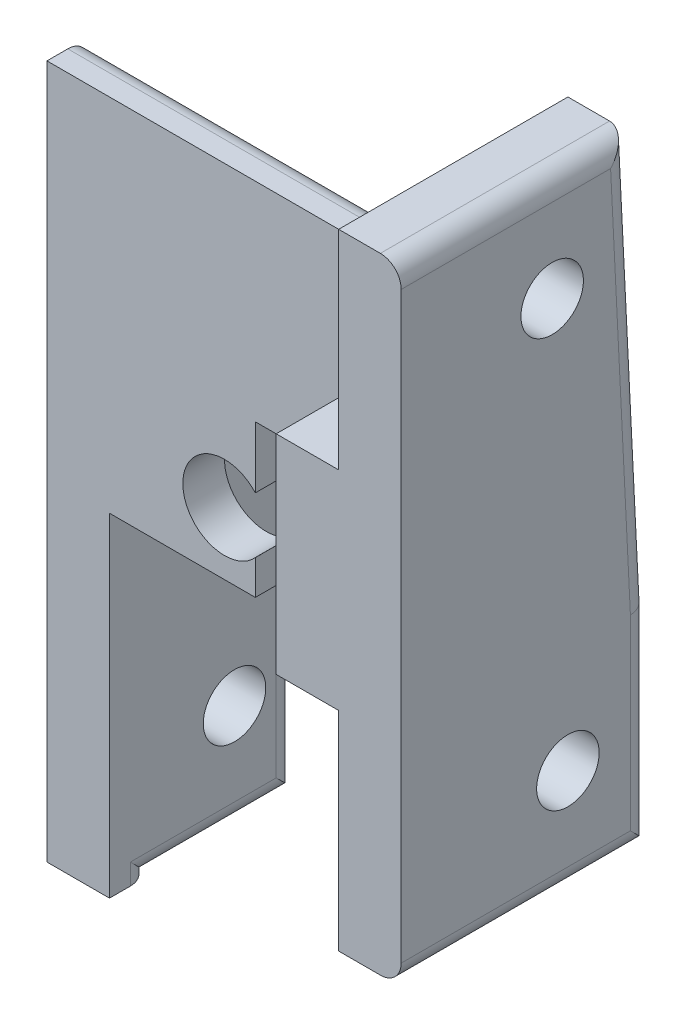
from build123d import *

# Parameters (mm, degrees)
CROQUIS1_W              = 24
CROQUIS1_H              = 33.3
SALIENTE_EXTRUIR2_DEPTH = 7
CROQUIS3_W              = 4
CROQUIS3_H              = 19
CORTAR_EXTRUIR1_DEPTH   = 42.640004803
CROQUIS7_R              = 1.5
SALIENTE_EXTRUIR3_DEPTH = 3
CROQUIS8_W              = 18
CROQUIS8_H              = 10
CROQUIS8_R              = 1.5
SALIENTE_EXTRUIR5_DEPTH = 3
SALIENTE_EXTRUIR6_START = -2
CROQUIS9_W              = 18
CROQUIS9_H              = 10
CROQUIS9_R              = 1.5
SALIENTE_EXTRUIR6_DEPTH = 2
CROQUIS10_W             = 24
CROQUIS10_H             = 10
SALIENTE_EXTRUIR7_DEPTH = 3
CROQUIS11_W             = 19
CROQUIS11_H             = 38
CORTAR_EXTRUIR5_DEPTH   = 57.986752847
CROQUIS15_W             = 7
CROQUIS15_H             = 10
CORTAR_EXTRUIR8_DEPTH   = 59.004223984
CROQUIS16_W             = 7
CROQUIS16_H             = 16
CORTAR_EXTRUIR9_DEPTH   = 2
CROQUIS18_R             = 1.5
CROQUIS18_W             = 24
CROQUIS18_H             = 10
SALIENTE_EXTRUIR8_DEPTH = 3
REDONDEO1_R             = 1
CROQUIS19_W             = 27
CROQUIS19_H             = 19
CORTAR_EXTRUIR11_DEPTH  = 67.973800848
CROQUIS21_R             = 2
CORTAR_EXTRUIR12_DEPTH  = 10
CROQUIS22_W             = 12
CROQUIS22_H             = 11
CORTAR_EXTRUIR13_DEPTH  = 52.792760112


with BuildPart() as part:
    # Croquis1 → Saliente-Extruir2 (new body)
    with BuildSketch(Plane(origin=(0, 0, 0), x_dir=(0, 0, -1), z_dir=(1, 0, 0))):
        with Locations((-12, -16.65)):
            Rectangle(CROQUIS1_W, CROQUIS1_H)
    extrude(amount=SALIENTE_EXTRUIR2_DEPTH)

    # Croquis3 → Cortar-Extruir1 (cut, through all)
    with BuildSketch(Plane(origin=(0, 0, 0), x_dir=(1, 0, 0), z_dir=(0, 1, 0))):
        with Locations((5, -11.5)):
            Rectangle(CROQUIS3_W, CROQUIS3_H)
    extrude(amount=-CORTAR_EXTRUIR1_DEPTH, mode=Mode.SUBTRACT)



with BuildPart() as body_2:
    # Croquis7 → Saliente-Extruir3 (new body)
    with BuildSketch(Plane.ZY):
        Polygon((-7, 0), (-7, -33.3), (0, -33.3), (0, -44.3), (24, -44.3), (24, -33.3), (31, -33.3), (31, 0), align=None)
        with Locations((-4, -28.3)):
            Circle(CROQUIS7_R, mode=Mode.SUBTRACT)
        with Locations((-4, -15)):
            Circle(CROQUIS7_R, mode=Mode.SUBTRACT)
        with Locations((28, -15)):
            Circle(CROQUIS7_R, mode=Mode.SUBTRACT)
        with Locations((28, -28.3)):
            Circle(CROQUIS7_R, mode=Mode.SUBTRACT)
        with Locations((20, -40.3)):
            Circle(CROQUIS7_R, mode=Mode.SUBTRACT)
        with Locations((4, -40.3)):
            Circle(CROQUIS7_R, mode=Mode.SUBTRACT)
    extrude(amount=SALIENTE_EXTRUIR3_DEPTH)


with BuildPart() as part_1:
    add(part.part)

    add(body_2.part)  # Saliente-Extruir5 merges body 2
    # Croquis8 → Saliente-Extruir5 (add)
    with BuildSketch(Plane.XY.offset(24)):
        with Locations((9, -5)):
            Rectangle(CROQUIS8_W, CROQUIS8_H)
        with Locations((15, -5)):
            Circle(CROQUIS8_R, mode=Mode.SUBTRACT)
        with Locations((3, -5)):
            Circle(CROQUIS8_R, mode=Mode.SUBTRACT)
    extrude(amount=-SALIENTE_EXTRUIR5_DEPTH)

    # Croquis9 → Saliente-Extruir6 (add)
    with BuildSketch(Plane(origin=(0, 0, 0), x_dir=(-1, 0, 0), z_dir=(0, 0, -1)).offset(SALIENTE_EXTRUIR6_START)):
        with Locations((-9, -5)):
            Rectangle(CROQUIS9_W, CROQUIS9_H)
        with Locations(Location((-15, -5, 0), (0, 0, 180))):
            Circle(CROQUIS9_R, mode=Mode.SUBTRACT)
    extrude(amount=SALIENTE_EXTRUIR6_DEPTH)

    # Croquis10 → Saliente-Extruir7 (add)
    with BuildSketch(Plane(origin=(18, 0, 0), x_dir=(0, 0, -1), z_dir=(1, 0, 0))):
        with Locations((-12, -5)):
            Rectangle(CROQUIS10_W, CROQUIS10_H)
    extrude(amount=SALIENTE_EXTRUIR7_DEPTH)

    # Croquis11 → Cortar-Extruir5 (cut, through all)
    with BuildSketch(Plane(origin=(3, 0, 0), x_dir=(0, 0, -1), z_dir=(1, 0, 0))):
        with Locations((-11.5, -19)):
            Rectangle(CROQUIS11_W, CROQUIS11_H)
    extrude(amount=-CORTAR_EXTRUIR5_DEPTH, mode=Mode.SUBTRACT)

    # Croquis15 → Cortar-Extruir8 (cut, through all)
    with BuildSketch(Plane(origin=(0, 0, 0), x_dir=(0, 0, -1), z_dir=(1, 0, 0))):
        with Locations((-27.5, -5)):
            Rectangle(CROQUIS15_W, CROQUIS15_H)
        with Locations((3.5, -5)):
            Rectangle(CROQUIS15_W, CROQUIS15_H)
    extrude(amount=-CORTAR_EXTRUIR8_DEPTH, mode=Mode.SUBTRACT)

    # Croquis16 → Cortar-Extruir9 (cut)
    with BuildSketch(Plane(origin=(0, 0, 0), x_dir=(-1, 0, 0), z_dir=(0, 0, -1))):
        with Locations((-3.5, -25.3)):
            Rectangle(CROQUIS16_W, CROQUIS16_H)
    extrude(amount=-CORTAR_EXTRUIR9_DEPTH, mode=Mode.SUBTRACT)

    # Croquis18 → Saliente-Extruir8 (add)
    # profile 1 of 2: a face of its own
    with BuildSketch(Plane(origin=(21, 0, 0), x_dir=(0, 0, -1), z_dir=(1, 0, 0))):
        Polygon((-24, 10), (-24, -10), (0, -10), (-1, 10), align=None)
        with Locations((-20, 5)):
            Circle(CROQUIS18_R, mode=Mode.SUBTRACT)
        with Locations((-4.754996879, 5)):
            Circle(CROQUIS18_R, mode=Mode.SUBTRACT)
    # profile 2 of 2: a face of its own
    with BuildSketch(Plane(origin=(21, 0, 0), x_dir=(0, 0, -1), z_dir=(1, 0, 0))):
        with Locations((-12, -15)):
            Rectangle(CROQUIS18_W, CROQUIS18_H)
        with Locations((-20, -15)):
            Circle(CROQUIS18_R, mode=Mode.SUBTRACT)
        with Locations((-4, -15)):
            Circle(CROQUIS18_R, mode=Mode.SUBTRACT)
    extrude(amount=SALIENTE_EXTRUIR8_DEPTH)

    # Redondeo1
    # the kernel refuses this fillet: 1 mm, written as the material it takes off along each edge
    with BuildSketch(Plane(origin=(0, -33.3, 31), x_dir=(0, 0, -1), z_dir=(0, 1, 0)), Plane(origin=(0, -10, -7), x_dir=(0, 0, 1), z_dir=(0, -1, 0))) as redondeo1_piece_1:
        with BuildLine():
            CenterArc((REDONDEO1_R, REDONDEO1_R), REDONDEO1_R, 180, 90)
            Line((0, REDONDEO1_R), (-REDONDEO1_R * 0.02, REDONDEO1_R))
            Line((-REDONDEO1_R * 0.02, REDONDEO1_R), (-REDONDEO1_R * 0.02, -REDONDEO1_R * 0.02))
            Line((-REDONDEO1_R * 0.02, -REDONDEO1_R * 0.02), (REDONDEO1_R, -REDONDEO1_R * 0.02))
            Line((REDONDEO1_R, -REDONDEO1_R * 0.02), (REDONDEO1_R, 0))
        make_face()
    extrude(amount=23.3, mode=Mode.SUBTRACT)
    with BuildSketch(Plane(origin=(0, -10, 24), x_dir=(-1, 0, 0), z_dir=(0, 0, 1)), Plane(origin=(0, -10, -7), x_dir=(-1, 0, 0), z_dir=(0, 0, 1)), Plane(origin=(0, -33.3, 24), x_dir=(0, 1, 0), z_dir=(0, 0, 1)), Plane(origin=(0, -33.3, -7), x_dir=(0, 1, 0), z_dir=(0, 0, 1))) as redondeo1_piece_2:
        with BuildLine():
            CenterArc((REDONDEO1_R, REDONDEO1_R), REDONDEO1_R, 180, 90)
            Line((0, REDONDEO1_R), (-REDONDEO1_R * 0.02, REDONDEO1_R))
            Line((-REDONDEO1_R * 0.02, REDONDEO1_R), (-REDONDEO1_R * 0.02, -REDONDEO1_R * 0.02))
            Line((-REDONDEO1_R * 0.02, -REDONDEO1_R * 0.02), (REDONDEO1_R, -REDONDEO1_R * 0.02))
            Line((REDONDEO1_R, -REDONDEO1_R * 0.02), (REDONDEO1_R, 0))
        make_face()
    extrude(amount=7, mode=Mode.SUBTRACT)
    with BuildSketch(Plane(origin=(24, -20, 24), x_dir=(-1, 0, 0), z_dir=(0, 1, 0))) as redondeo1_piece_3:
        with BuildLine():
            CenterArc((REDONDEO1_R, -REDONDEO1_R), REDONDEO1_R, 90, 90)
            Line((0, -REDONDEO1_R), (-REDONDEO1_R * 0.02, -REDONDEO1_R))
            Line((-REDONDEO1_R * 0.02, -REDONDEO1_R), (-REDONDEO1_R * 0.02, REDONDEO1_R * 0.02))
            Line((-REDONDEO1_R * 0.02, REDONDEO1_R * 0.02), (REDONDEO1_R, REDONDEO1_R * 0.02))
            Line((REDONDEO1_R, REDONDEO1_R * 0.02), (REDONDEO1_R, 0))
        make_face()
    extrude(amount=30, mode=Mode.SUBTRACT)
    with BuildSketch(Plane(origin=(24, -20, 0), x_dir=(0, 0, 1), z_dir=(0, 1, 0))) as redondeo1_piece_4_section:
        with BuildLine():
            CenterArc((REDONDEO1_R, -REDONDEO1_R), REDONDEO1_R, 90, 90)
            Line((0, -REDONDEO1_R), (-REDONDEO1_R * 0.02, -REDONDEO1_R))
            Line((-REDONDEO1_R * 0.02, -REDONDEO1_R), (-REDONDEO1_R * 0.02, REDONDEO1_R * 0.02))
            Line((-REDONDEO1_R * 0.02, REDONDEO1_R * 0.02), (REDONDEO1_R, REDONDEO1_R * 0.02))
            Line((REDONDEO1_R, REDONDEO1_R * 0.02), (REDONDEO1_R, 0))
        make_face()
    redondeo1_piece_4 = extrude(amount=12.5, mode=Mode.PRIVATE)
    redondeo1_piece_4 = split(redondeo1_piece_4, bisect_by=Plane(origin=(23.783903018, -14.02846616, -0.201423308), z_dir=(0, -0.049937616943892635, 0.9987523388778446)), keep=Keep.TOP, mode=Mode.PRIVATE)
    add(redondeo1_piece_4, mode=Mode.SUBTRACT)
    with BuildSketch(Plane(origin=(24, 10, -1.5), x_dir=(-1, 0, 0), z_dir=(0, 0, 1))) as redondeo1_piece_5_section:
        with BuildLine():
            CenterArc((REDONDEO1_R, REDONDEO1_R), REDONDEO1_R, 180, 90)
            Line((0, REDONDEO1_R), (-REDONDEO1_R * 0.02, REDONDEO1_R))
            Line((-REDONDEO1_R * 0.02, REDONDEO1_R), (-REDONDEO1_R * 0.02, -REDONDEO1_R * 0.02))
            Line((-REDONDEO1_R * 0.02, -REDONDEO1_R * 0.02), (REDONDEO1_R, -REDONDEO1_R * 0.02))
            Line((REDONDEO1_R, -REDONDEO1_R * 0.02), (REDONDEO1_R, 0))
        make_face()
    redondeo1_piece_5 = extrude(amount=25.5, mode=Mode.PRIVATE)
    redondeo1_piece_5 = split(redondeo1_piece_5, bisect_by=Plane(origin=(23.773664545, 10.347352398, 1.01736762), z_dir=(0, -0.049937616943892635, 0.9987523388778446)), keep=Keep.TOP, mode=Mode.PRIVATE)
    add(redondeo1_piece_5, mode=Mode.SUBTRACT)
    with BuildSketch(Plane(origin=(24, -20, 24), x_dir=(0, 1, 0), z_dir=(0, 0, -1)), Plane(origin=(-3, 0, 24), x_dir=(0, 0, -1), z_dir=(1, 0, 0)), Plane(origin=(21, 0, 0), x_dir=(0, 0, 1), z_dir=(-1, 0, 0))) as redondeo1_piece_6:
        with BuildLine():
            CenterArc((REDONDEO1_R, -REDONDEO1_R), REDONDEO1_R, 90, 90)
            Line((0, -REDONDEO1_R), (-REDONDEO1_R * 0.02, -REDONDEO1_R))
            Line((-REDONDEO1_R * 0.02, -REDONDEO1_R), (-REDONDEO1_R * 0.02, REDONDEO1_R * 0.02))
            Line((-REDONDEO1_R * 0.02, REDONDEO1_R * 0.02), (REDONDEO1_R, REDONDEO1_R * 0.02))
            Line((REDONDEO1_R, REDONDEO1_R * 0.02), (REDONDEO1_R, 0))
        make_face()
    extrude(amount=24, mode=Mode.SUBTRACT)
    with BuildSketch(Plane(origin=(24, -12.496880847, -0.124844042), x_dir=(-1, 0, 0), z_dir=(0, 0.9987523388778446, 0.049937616943892635))) as redondeo1_piece_7_section:
        with BuildLine():
            CenterArc((REDONDEO1_R, REDONDEO1_R), REDONDEO1_R, 180, 90)
            Line((0, REDONDEO1_R), (-REDONDEO1_R * 0.02, REDONDEO1_R))
            Line((-REDONDEO1_R * 0.02, REDONDEO1_R), (-REDONDEO1_R * 0.02, -REDONDEO1_R * 0.02))
            Line((-REDONDEO1_R * 0.02, -REDONDEO1_R * 0.02), (REDONDEO1_R, -REDONDEO1_R * 0.02))
            Line((REDONDEO1_R, -REDONDEO1_R * 0.02), (REDONDEO1_R, 0))
        make_face()
    redondeo1_piece_7 = extrude(amount=25.024984395, mode=Mode.PRIVATE)
    redondeo1_piece_7 = split(redondeo1_piece_7, bisect_by=Plane(origin=(23.779237021, -0.936247577, 0), z_dir=(0, 0, 1)), keep=Keep.TOP, mode=Mode.PRIVATE)
    redondeo1_piece_7 = split(redondeo1_piece_7, bisect_by=Plane(origin=(23.779237021, 10, 0.686324779), z_dir=(0, -1, 0)), keep=Keep.TOP, mode=Mode.PRIVATE)
    add(redondeo1_piece_7, mode=Mode.SUBTRACT)
    with BuildSketch(Plane(origin=(7, -33.3, 24), x_dir=(-1, 0, 0), z_dir=(0, 1, 0))) as redondeo1_piece_8:
        with BuildLine():
            CenterArc((REDONDEO1_R, -REDONDEO1_R), REDONDEO1_R, 90, 90)
            Line((0, -REDONDEO1_R), (-REDONDEO1_R * 0.02, -REDONDEO1_R))
            Line((-REDONDEO1_R * 0.02, -REDONDEO1_R), (-REDONDEO1_R * 0.02, REDONDEO1_R * 0.02))
            Line((-REDONDEO1_R * 0.02, REDONDEO1_R * 0.02), (REDONDEO1_R, REDONDEO1_R * 0.02))
            Line((REDONDEO1_R, REDONDEO1_R * 0.02), (REDONDEO1_R, 0))
        make_face()
    extrude(amount=23.3, mode=Mode.SUBTRACT)
    with BuildSketch(Plane(origin=(7, -10, 24), x_dir=(0, 1, 0), z_dir=(1, 0, 0))) as redondeo1_piece_9:
        with BuildLine():
            CenterArc((REDONDEO1_R, -REDONDEO1_R), REDONDEO1_R, 90, 90)
            Line((0, -REDONDEO1_R), (-REDONDEO1_R * 0.02, -REDONDEO1_R))
            Line((-REDONDEO1_R * 0.02, -REDONDEO1_R), (-REDONDEO1_R * 0.02, REDONDEO1_R * 0.02))
            Line((-REDONDEO1_R * 0.02, REDONDEO1_R * 0.02), (REDONDEO1_R, REDONDEO1_R * 0.02))
            Line((REDONDEO1_R, REDONDEO1_R * 0.02), (REDONDEO1_R, 0))
        make_face()
    extrude(amount=14, mode=Mode.SUBTRACT)
    with BuildSketch(Plane(origin=(0, -33.3, 0), x_dir=(0, 0, 1), z_dir=(0, -1, 0))) as redondeo1_piece_10:
        with BuildLine():
            CenterArc((REDONDEO1_R, REDONDEO1_R), REDONDEO1_R, 180, 90)
            Line((0, REDONDEO1_R), (-REDONDEO1_R * 0.02, REDONDEO1_R))
            Line((-REDONDEO1_R * 0.02, REDONDEO1_R), (-REDONDEO1_R * 0.02, -REDONDEO1_R * 0.02))
            Line((-REDONDEO1_R * 0.02, -REDONDEO1_R * 0.02), (REDONDEO1_R, -REDONDEO1_R * 0.02))
            Line((REDONDEO1_R, -REDONDEO1_R * 0.02), (REDONDEO1_R, 0))
        make_face()
    extrude(amount=11, mode=Mode.SUBTRACT)
    with BuildSketch(Plane(origin=(0, -44.3, 0), x_dir=(0, 1, 0), z_dir=(0, 0, 1))) as redondeo1_piece_11:
        with BuildLine():
            CenterArc((REDONDEO1_R, REDONDEO1_R), REDONDEO1_R, 180, 90)
            Line((0, REDONDEO1_R), (-REDONDEO1_R * 0.02, REDONDEO1_R))
            Line((-REDONDEO1_R * 0.02, REDONDEO1_R), (-REDONDEO1_R * 0.02, -REDONDEO1_R * 0.02))
            Line((-REDONDEO1_R * 0.02, -REDONDEO1_R * 0.02), (REDONDEO1_R, -REDONDEO1_R * 0.02))
            Line((REDONDEO1_R, -REDONDEO1_R * 0.02), (REDONDEO1_R, 0))
        make_face()
    extrude(amount=24, mode=Mode.SUBTRACT)
    with BuildSketch(Plane(origin=(0, -35.8, 31), x_dir=(0, 0, -1), z_dir=(0, 1, 0))) as redondeo1_piece_12a_section:
        with BuildLine():
            CenterArc((REDONDEO1_R, REDONDEO1_R), REDONDEO1_R, 180, 90)
            Line((0, REDONDEO1_R), (-REDONDEO1_R * 0.02, REDONDEO1_R))
            Line((-REDONDEO1_R * 0.02, REDONDEO1_R), (-REDONDEO1_R * 0.02, -REDONDEO1_R * 0.02))
            Line((-REDONDEO1_R * 0.02, -REDONDEO1_R * 0.02), (REDONDEO1_R, -REDONDEO1_R * 0.02))
            Line((REDONDEO1_R, -REDONDEO1_R * 0.02), (REDONDEO1_R, 0))
        make_face()
    redondeo1_piece_12a = extrude(amount=25.8, mode=Mode.PRIVATE)
    redondeo1_piece_12a = split(redondeo1_piece_12a, bisect_by=Plane(origin=(-0.226395114, -33.3, 30.773604886), z_dir=(0, -1, 0)), keep=Keep.TOP, mode=Mode.PRIVATE)
    with BuildSketch(Plane(origin=(0, -33.3, 24), x_dir=(0, 1, 0), z_dir=(0, 0, 1))) as redondeo1_piece_12b_section:
        with BuildLine():
            CenterArc((REDONDEO1_R, REDONDEO1_R), REDONDEO1_R, 180, 90)
            Line((0, REDONDEO1_R), (-REDONDEO1_R * 0.02, REDONDEO1_R))
            Line((-REDONDEO1_R * 0.02, REDONDEO1_R), (-REDONDEO1_R * 0.02, -REDONDEO1_R * 0.02))
            Line((-REDONDEO1_R * 0.02, -REDONDEO1_R * 0.02), (REDONDEO1_R, -REDONDEO1_R * 0.02))
            Line((REDONDEO1_R, -REDONDEO1_R * 0.02), (REDONDEO1_R, 0))
        make_face()
    redondeo1_piece_12b = extrude(amount=9.5, mode=Mode.PRIVATE)
    redondeo1_piece_12b = split(redondeo1_piece_12b, bisect_by=Plane(origin=(-0.226395114, -33.073604886, 31), z_dir=(0, 0, 1)), keep=Keep.TOP, mode=Mode.PRIVATE)
    redondeo1_piece_12 = redondeo1_piece_12a & redondeo1_piece_12b
    add(redondeo1_piece_12, mode=Mode.SUBTRACT)
    with BuildSketch(Plane(origin=(0, -10, 24), x_dir=(-1, 0, 0), z_dir=(0, 0, 1))) as redondeo1_piece_13a_section:
        with BuildLine():
            CenterArc((REDONDEO1_R, REDONDEO1_R), REDONDEO1_R, 180, 90)
            Line((0, REDONDEO1_R), (-REDONDEO1_R * 0.02, REDONDEO1_R))
            Line((-REDONDEO1_R * 0.02, REDONDEO1_R), (-REDONDEO1_R * 0.02, -REDONDEO1_R * 0.02))
            Line((-REDONDEO1_R * 0.02, -REDONDEO1_R * 0.02), (REDONDEO1_R, -REDONDEO1_R * 0.02))
            Line((REDONDEO1_R, -REDONDEO1_R * 0.02), (REDONDEO1_R, 0))
        make_face()
    redondeo1_piece_13a = extrude(amount=9.5, mode=Mode.PRIVATE)
    redondeo1_piece_13a = split(redondeo1_piece_13a, bisect_by=Plane(origin=(-0.226395114, -10.226395114, 31), z_dir=(0, 0, 1)), keep=Keep.TOP, mode=Mode.PRIVATE)
    with BuildSketch(Plane(origin=(0, -33.3, 31), x_dir=(0, 0, -1), z_dir=(0, 1, 0))) as redondeo1_piece_13b_section:
        with BuildLine():
            CenterArc((REDONDEO1_R, REDONDEO1_R), REDONDEO1_R, 180, 90)
            Line((0, REDONDEO1_R), (-REDONDEO1_R * 0.02, REDONDEO1_R))
            Line((-REDONDEO1_R * 0.02, REDONDEO1_R), (-REDONDEO1_R * 0.02, -REDONDEO1_R * 0.02))
            Line((-REDONDEO1_R * 0.02, -REDONDEO1_R * 0.02), (REDONDEO1_R, -REDONDEO1_R * 0.02))
            Line((REDONDEO1_R, -REDONDEO1_R * 0.02), (REDONDEO1_R, 0))
        make_face()
    redondeo1_piece_13b = extrude(amount=25.8, mode=Mode.PRIVATE)
    redondeo1_piece_13b = split(redondeo1_piece_13b, bisect_by=Plane(origin=(-0.226395114, -10, 30.773604886), z_dir=(0, 1, 0)), keep=Keep.TOP, mode=Mode.PRIVATE)
    redondeo1_piece_13 = redondeo1_piece_13a & redondeo1_piece_13b
    add(redondeo1_piece_13, mode=Mode.SUBTRACT)
    with BuildSketch(Plane(origin=(0, -10, -9.5), x_dir=(-1, 0, 0), z_dir=(0, 0, 1))) as redondeo1_piece_14a_section:
        with BuildLine():
            CenterArc((REDONDEO1_R, REDONDEO1_R), REDONDEO1_R, 180, 90)
            Line((0, REDONDEO1_R), (-REDONDEO1_R * 0.02, REDONDEO1_R))
            Line((-REDONDEO1_R * 0.02, REDONDEO1_R), (-REDONDEO1_R * 0.02, -REDONDEO1_R * 0.02))
            Line((-REDONDEO1_R * 0.02, -REDONDEO1_R * 0.02), (REDONDEO1_R, -REDONDEO1_R * 0.02))
            Line((REDONDEO1_R, -REDONDEO1_R * 0.02), (REDONDEO1_R, 0))
        make_face()
    redondeo1_piece_14a = extrude(amount=9.5, mode=Mode.PRIVATE)
    redondeo1_piece_14a = split(redondeo1_piece_14a, bisect_by=Plane(origin=(-0.226395114, -10.226395114, -7), z_dir=(0, 0, -1)), keep=Keep.TOP, mode=Mode.PRIVATE)
    with BuildSketch(Plane(origin=(0, -7.5, -7), x_dir=(0, 0, 1), z_dir=(0, -1, 0))) as redondeo1_piece_14b_section:
        with BuildLine():
            CenterArc((REDONDEO1_R, REDONDEO1_R), REDONDEO1_R, 180, 90)
            Line((0, REDONDEO1_R), (-REDONDEO1_R * 0.02, REDONDEO1_R))
            Line((-REDONDEO1_R * 0.02, REDONDEO1_R), (-REDONDEO1_R * 0.02, -REDONDEO1_R * 0.02))
            Line((-REDONDEO1_R * 0.02, -REDONDEO1_R * 0.02), (REDONDEO1_R, -REDONDEO1_R * 0.02))
            Line((REDONDEO1_R, -REDONDEO1_R * 0.02), (REDONDEO1_R, 0))
        make_face()
    redondeo1_piece_14b = extrude(amount=25.8, mode=Mode.PRIVATE)
    redondeo1_piece_14b = split(redondeo1_piece_14b, bisect_by=Plane(origin=(-0.226395114, -10, -6.773604886), z_dir=(0, 1, 0)), keep=Keep.TOP, mode=Mode.PRIVATE)
    redondeo1_piece_14 = redondeo1_piece_14a & redondeo1_piece_14b
    add(redondeo1_piece_14, mode=Mode.SUBTRACT)
    with BuildSketch(Plane(origin=(0, -10, -7), x_dir=(0, 0, 1), z_dir=(0, -1, 0))) as redondeo1_piece_15a_section:
        with BuildLine():
            CenterArc((REDONDEO1_R, REDONDEO1_R), REDONDEO1_R, 180, 90)
            Line((0, REDONDEO1_R), (-REDONDEO1_R * 0.02, REDONDEO1_R))
            Line((-REDONDEO1_R * 0.02, REDONDEO1_R), (-REDONDEO1_R * 0.02, -REDONDEO1_R * 0.02))
            Line((-REDONDEO1_R * 0.02, -REDONDEO1_R * 0.02), (REDONDEO1_R, -REDONDEO1_R * 0.02))
            Line((REDONDEO1_R, -REDONDEO1_R * 0.02), (REDONDEO1_R, 0))
        make_face()
    redondeo1_piece_15a = extrude(amount=25.8, mode=Mode.PRIVATE)
    redondeo1_piece_15a = split(redondeo1_piece_15a, bisect_by=Plane(origin=(-0.226395114, -33.3, -6.773604886), z_dir=(0, -1, 0)), keep=Keep.TOP, mode=Mode.PRIVATE)
    with BuildSketch(Plane(origin=(0, -33.3, -9.5), x_dir=(0, 1, 0), z_dir=(0, 0, 1))) as redondeo1_piece_15b_section:
        with BuildLine():
            CenterArc((REDONDEO1_R, REDONDEO1_R), REDONDEO1_R, 180, 90)
            Line((0, REDONDEO1_R), (-REDONDEO1_R * 0.02, REDONDEO1_R))
            Line((-REDONDEO1_R * 0.02, REDONDEO1_R), (-REDONDEO1_R * 0.02, -REDONDEO1_R * 0.02))
            Line((-REDONDEO1_R * 0.02, -REDONDEO1_R * 0.02), (REDONDEO1_R, -REDONDEO1_R * 0.02))
            Line((REDONDEO1_R, -REDONDEO1_R * 0.02), (REDONDEO1_R, 0))
        make_face()
    redondeo1_piece_15b = extrude(amount=9.5, mode=Mode.PRIVATE)
    redondeo1_piece_15b = split(redondeo1_piece_15b, bisect_by=Plane(origin=(-0.226395114, -33.073604886, -7), z_dir=(0, 0, -1)), keep=Keep.TOP, mode=Mode.PRIVATE)
    redondeo1_piece_15 = redondeo1_piece_15a & redondeo1_piece_15b
    add(redondeo1_piece_15, mode=Mode.SUBTRACT)
    with BuildSketch(Plane(origin=(24, -22.5, 24), x_dir=(-1, 0, 0), z_dir=(0, 1, 0))) as redondeo1_piece_16a_section:
        with BuildLine():
            CenterArc((REDONDEO1_R, -REDONDEO1_R), REDONDEO1_R, 90, 90)
            Line((0, -REDONDEO1_R), (-REDONDEO1_R * 0.02, -REDONDEO1_R))
            Line((-REDONDEO1_R * 0.02, -REDONDEO1_R), (-REDONDEO1_R * 0.02, REDONDEO1_R * 0.02))
            Line((-REDONDEO1_R * 0.02, REDONDEO1_R * 0.02), (REDONDEO1_R, REDONDEO1_R * 0.02))
            Line((REDONDEO1_R, REDONDEO1_R * 0.02), (REDONDEO1_R, 0))
        make_face()
    redondeo1_piece_16a = extrude(amount=32.5, mode=Mode.PRIVATE)
    redondeo1_piece_16a = split(redondeo1_piece_16a, bisect_by=Plane(origin=(23.773604886, -20, 23.773604886), z_dir=(0, -1, 0)), keep=Keep.TOP, mode=Mode.PRIVATE)
    with BuildSketch(Plane(origin=(24, -20, 26.5), x_dir=(0, 1, 0), z_dir=(0, 0, -1))) as redondeo1_piece_16b_section:
        with BuildLine():
            CenterArc((REDONDEO1_R, -REDONDEO1_R), REDONDEO1_R, 90, 90)
            Line((0, -REDONDEO1_R), (-REDONDEO1_R * 0.02, -REDONDEO1_R))
            Line((-REDONDEO1_R * 0.02, -REDONDEO1_R), (-REDONDEO1_R * 0.02, REDONDEO1_R * 0.02))
            Line((-REDONDEO1_R * 0.02, REDONDEO1_R * 0.02), (REDONDEO1_R, REDONDEO1_R * 0.02))
            Line((REDONDEO1_R, REDONDEO1_R * 0.02), (REDONDEO1_R, 0))
        make_face()
    redondeo1_piece_16b = extrude(amount=26.5, mode=Mode.PRIVATE)
    redondeo1_piece_16b = split(redondeo1_piece_16b, bisect_by=Plane(origin=(23.773604886, -19.773604886, 24), z_dir=(0, 0, 1)), keep=Keep.TOP, mode=Mode.PRIVATE)
    redondeo1_piece_16 = redondeo1_piece_16a & redondeo1_piece_16b
    add(redondeo1_piece_16, mode=Mode.SUBTRACT)
    with BuildSketch(Plane(origin=(24, -20, 24), x_dir=(-1, 0, 0), z_dir=(0, 1, 0))) as redondeo1_piece_17a_section:
        with BuildLine():
            CenterArc((REDONDEO1_R, -REDONDEO1_R), REDONDEO1_R, 90, 90)
            Line((0, -REDONDEO1_R), (-REDONDEO1_R * 0.02, -REDONDEO1_R))
            Line((-REDONDEO1_R * 0.02, -REDONDEO1_R), (-REDONDEO1_R * 0.02, REDONDEO1_R * 0.02))
            Line((-REDONDEO1_R * 0.02, REDONDEO1_R * 0.02), (REDONDEO1_R, REDONDEO1_R * 0.02))
            Line((REDONDEO1_R, REDONDEO1_R * 0.02), (REDONDEO1_R, 0))
        make_face()
    redondeo1_piece_17a = extrude(amount=32.5, mode=Mode.PRIVATE)
    redondeo1_piece_17a = split(redondeo1_piece_17a, bisect_by=Plane(origin=(23.773604886, 10, 23.773604886), z_dir=(0, 1, 0)), keep=Keep.TOP, mode=Mode.PRIVATE)
    with BuildSketch(Plane(origin=(24, 10, -1.5), x_dir=(-1, 0, 0), z_dir=(0, 0, 1))) as redondeo1_piece_17b_section:
        with BuildLine():
            CenterArc((REDONDEO1_R, REDONDEO1_R), REDONDEO1_R, 180, 90)
            Line((0, REDONDEO1_R), (-REDONDEO1_R * 0.02, REDONDEO1_R))
            Line((-REDONDEO1_R * 0.02, REDONDEO1_R), (-REDONDEO1_R * 0.02, -REDONDEO1_R * 0.02))
            Line((-REDONDEO1_R * 0.02, -REDONDEO1_R * 0.02), (REDONDEO1_R, -REDONDEO1_R * 0.02))
            Line((REDONDEO1_R, -REDONDEO1_R * 0.02), (REDONDEO1_R, 0))
        make_face()
    redondeo1_piece_17b = extrude(amount=28, mode=Mode.PRIVATE)
    redondeo1_piece_17b = split(redondeo1_piece_17b, bisect_by=Plane(origin=(23.773604886, 9.773604886, 24), z_dir=(0, 0, 1)), keep=Keep.TOP, mode=Mode.PRIVATE)
    redondeo1_piece_17 = redondeo1_piece_17a & redondeo1_piece_17b
    add(redondeo1_piece_17, mode=Mode.SUBTRACT)
    with BuildSketch(Plane(origin=(24, -20, 24), x_dir=(0, 1, 0), z_dir=(0, 0, -1))) as redondeo1_piece_18a_section:
        with BuildLine():
            CenterArc((REDONDEO1_R, -REDONDEO1_R), REDONDEO1_R, 90, 90)
            Line((0, -REDONDEO1_R), (-REDONDEO1_R * 0.02, -REDONDEO1_R))
            Line((-REDONDEO1_R * 0.02, -REDONDEO1_R), (-REDONDEO1_R * 0.02, REDONDEO1_R * 0.02))
            Line((-REDONDEO1_R * 0.02, REDONDEO1_R * 0.02), (REDONDEO1_R, REDONDEO1_R * 0.02))
            Line((REDONDEO1_R, REDONDEO1_R * 0.02), (REDONDEO1_R, 0))
        make_face()
    redondeo1_piece_18a = extrude(amount=26.5, mode=Mode.PRIVATE)
    redondeo1_piece_18a = split(redondeo1_piece_18a, bisect_by=Plane(origin=(23.773604886, -19.773604886, 0), z_dir=(0, 0, -1)), keep=Keep.TOP, mode=Mode.PRIVATE)
    with BuildSketch(Plane(origin=(24, -22.5, 0), x_dir=(0, 0, 1), z_dir=(0, 1, 0))) as redondeo1_piece_18b_section:
        with BuildLine():
            CenterArc((REDONDEO1_R, -REDONDEO1_R), REDONDEO1_R, 90, 90)
            Line((0, -REDONDEO1_R), (-REDONDEO1_R * 0.02, -REDONDEO1_R))
            Line((-REDONDEO1_R * 0.02, -REDONDEO1_R), (-REDONDEO1_R * 0.02, REDONDEO1_R * 0.02))
            Line((-REDONDEO1_R * 0.02, REDONDEO1_R * 0.02), (REDONDEO1_R, REDONDEO1_R * 0.02))
            Line((REDONDEO1_R, REDONDEO1_R * 0.02), (REDONDEO1_R, 0))
        make_face()
    redondeo1_piece_18b = extrude(amount=15, mode=Mode.PRIVATE)
    redondeo1_piece_18b = split(redondeo1_piece_18b, bisect_by=Plane(origin=(23.773604886, -20, 0.226395114), z_dir=(0, -1, 0)), keep=Keep.TOP, mode=Mode.PRIVATE)
    redondeo1_piece_18 = redondeo1_piece_18a & redondeo1_piece_18b
    add(redondeo1_piece_18, mode=Mode.SUBTRACT)
    with BuildSketch(Plane(origin=(24, -12.496880847, -0.124844042), x_dir=(-1, 0, 0), z_dir=(0, 0.9987523388778446, 0.049937616943892635))) as redondeo1_piece_19a_section:
        with BuildLine():
            CenterArc((REDONDEO1_R, REDONDEO1_R), REDONDEO1_R, 180, 90)
            Line((0, REDONDEO1_R), (-REDONDEO1_R * 0.02, REDONDEO1_R))
            Line((-REDONDEO1_R * 0.02, REDONDEO1_R), (-REDONDEO1_R * 0.02, -REDONDEO1_R * 0.02))
            Line((-REDONDEO1_R * 0.02, -REDONDEO1_R * 0.02), (REDONDEO1_R, -REDONDEO1_R * 0.02))
            Line((REDONDEO1_R, -REDONDEO1_R * 0.02), (REDONDEO1_R, 0))
        make_face()
    redondeo1_piece_19a = extrude(amount=25.024984395, mode=Mode.PRIVATE)
    redondeo1_piece_19a = split(redondeo1_piece_19a, bisect_by=Plane(origin=(23.594544585, -11.473288765, 0), z_dir=(0, 0, -1)), keep=Keep.TOP, mode=Mode.PRIVATE)
    with BuildSketch(Plane(origin=(24, -20, 0), x_dir=(0, 0, 1), z_dir=(0, 1, 0))) as redondeo1_piece_19b_section:
        with BuildLine():
            CenterArc((REDONDEO1_R, -REDONDEO1_R), REDONDEO1_R, 90, 90)
            Line((0, -REDONDEO1_R), (-REDONDEO1_R * 0.02, -REDONDEO1_R))
            Line((-REDONDEO1_R * 0.02, -REDONDEO1_R), (-REDONDEO1_R * 0.02, REDONDEO1_R * 0.02))
            Line((-REDONDEO1_R * 0.02, REDONDEO1_R * 0.02), (REDONDEO1_R, REDONDEO1_R * 0.02))
            Line((REDONDEO1_R, REDONDEO1_R * 0.02), (REDONDEO1_R, 0))
        make_face()
    redondeo1_piece_19b = extrude(amount=12.5, mode=Mode.PRIVATE)
    redondeo1_piece_19b = split(redondeo1_piece_19b, bisect_by=Plane(origin=(23.594544585, -8.528549401, 0.07357253), z_dir=(0, 0.049937616943892635, -0.9987523388778446)), keep=Keep.TOP, mode=Mode.PRIVATE)
    redondeo1_piece_19 = redondeo1_piece_19a & redondeo1_piece_19b
    add(redondeo1_piece_19, mode=Mode.SUBTRACT)
    with BuildSketch(Plane(origin=(24, -12.496880847, -0.124844042), x_dir=(-1, 0, 0), z_dir=(0, 0.9987523388778446, 0.049937616943892635))) as redondeo1_piece_20a_section:
        with BuildLine():
            CenterArc((REDONDEO1_R, REDONDEO1_R), REDONDEO1_R, 180, 90)
            Line((0, REDONDEO1_R), (-REDONDEO1_R * 0.02, REDONDEO1_R))
            Line((-REDONDEO1_R * 0.02, REDONDEO1_R), (-REDONDEO1_R * 0.02, -REDONDEO1_R * 0.02))
            Line((-REDONDEO1_R * 0.02, -REDONDEO1_R * 0.02), (REDONDEO1_R, -REDONDEO1_R * 0.02))
            Line((REDONDEO1_R, -REDONDEO1_R * 0.02), (REDONDEO1_R, 0))
        make_face()
    redondeo1_piece_20a = extrude(amount=25.024984395, mode=Mode.PRIVATE)
    redondeo1_piece_20a = split(redondeo1_piece_20a, bisect_by=Plane(origin=(23.773053254, 10, 1.287883551), z_dir=(0, 1, 0)), keep=Keep.TOP, mode=Mode.PRIVATE)
    with BuildSketch(Plane(origin=(24, 10, -1.5), x_dir=(-1, 0, 0), z_dir=(0, 0, 1))) as redondeo1_piece_20b_section:
        with BuildLine():
            CenterArc((REDONDEO1_R, REDONDEO1_R), REDONDEO1_R, 180, 90)
            Line((0, REDONDEO1_R), (-REDONDEO1_R * 0.02, REDONDEO1_R))
            Line((-REDONDEO1_R * 0.02, REDONDEO1_R), (-REDONDEO1_R * 0.02, -REDONDEO1_R * 0.02))
            Line((-REDONDEO1_R * 0.02, -REDONDEO1_R * 0.02), (REDONDEO1_R, -REDONDEO1_R * 0.02))
            Line((REDONDEO1_R, -REDONDEO1_R * 0.02), (REDONDEO1_R, 0))
        make_face()
    redondeo1_piece_20b = extrude(amount=25.5, mode=Mode.PRIVATE)
    redondeo1_piece_20b = split(redondeo1_piece_20b, bisect_by=Plane(origin=(23.773053254, 9.71247563, 0.985623782), z_dir=(0, 0.049937616943892635, -0.9987523388778446)), keep=Keep.TOP, mode=Mode.PRIVATE)
    redondeo1_piece_20 = redondeo1_piece_20a & redondeo1_piece_20b
    add(redondeo1_piece_20, mode=Mode.SUBTRACT)
    with BuildSketch(Plane(origin=(7, -33.3, 24), x_dir=(-1, 0, 0), z_dir=(0, 1, 0))) as redondeo1_piece_21a_section:
        with BuildLine():
            CenterArc((REDONDEO1_R, -REDONDEO1_R), REDONDEO1_R, 90, 90)
            Line((0, -REDONDEO1_R), (-REDONDEO1_R * 0.02, -REDONDEO1_R))
            Line((-REDONDEO1_R * 0.02, -REDONDEO1_R), (-REDONDEO1_R * 0.02, REDONDEO1_R * 0.02))
            Line((-REDONDEO1_R * 0.02, REDONDEO1_R * 0.02), (REDONDEO1_R, REDONDEO1_R * 0.02))
            Line((REDONDEO1_R, REDONDEO1_R * 0.02), (REDONDEO1_R, 0))
        make_face()
    redondeo1_piece_21a = extrude(amount=25.8, mode=Mode.PRIVATE)
    redondeo1_piece_21a = split(redondeo1_piece_21a, bisect_by=Plane(origin=(6.773604886, -10, 23.773604886), z_dir=(0, 1, 0)), keep=Keep.TOP, mode=Mode.PRIVATE)
    with BuildSketch(Plane(origin=(4.5, -10, 24), x_dir=(0, 1, 0), z_dir=(1, 0, 0))) as redondeo1_piece_21b_section:
        with BuildLine():
            CenterArc((REDONDEO1_R, -REDONDEO1_R), REDONDEO1_R, 90, 90)
            Line((0, -REDONDEO1_R), (-REDONDEO1_R * 0.02, -REDONDEO1_R))
            Line((-REDONDEO1_R * 0.02, -REDONDEO1_R), (-REDONDEO1_R * 0.02, REDONDEO1_R * 0.02))
            Line((-REDONDEO1_R * 0.02, REDONDEO1_R * 0.02), (REDONDEO1_R, REDONDEO1_R * 0.02))
            Line((REDONDEO1_R, REDONDEO1_R * 0.02), (REDONDEO1_R, 0))
        make_face()
    redondeo1_piece_21b = extrude(amount=16.5, mode=Mode.PRIVATE)
    redondeo1_piece_21b = split(redondeo1_piece_21b, bisect_by=Plane(origin=(7, -9.773604886, 23.773604886), z_dir=(-1, 0, 0)), keep=Keep.TOP, mode=Mode.PRIVATE)
    redondeo1_piece_21 = redondeo1_piece_21a & redondeo1_piece_21b
    add(redondeo1_piece_21, mode=Mode.SUBTRACT)
    with BuildSketch(Plane(origin=(0, -33.3, -7), x_dir=(0, 1, 0), z_dir=(0, 0, 1))) as redondeo1_piece_22a_section:
        with BuildLine():
            CenterArc((REDONDEO1_R, REDONDEO1_R), REDONDEO1_R, 180, 90)
            Line((0, REDONDEO1_R), (-REDONDEO1_R * 0.02, REDONDEO1_R))
            Line((-REDONDEO1_R * 0.02, REDONDEO1_R), (-REDONDEO1_R * 0.02, -REDONDEO1_R * 0.02))
            Line((-REDONDEO1_R * 0.02, -REDONDEO1_R * 0.02), (REDONDEO1_R, -REDONDEO1_R * 0.02))
            Line((REDONDEO1_R, -REDONDEO1_R * 0.02), (REDONDEO1_R, 0))
        make_face()
    redondeo1_piece_22a = extrude(amount=9.5, mode=Mode.PRIVATE)
    redondeo1_piece_22a = split(redondeo1_piece_22a, bisect_by=Plane(origin=(-0.226395114, -33.073604886, 0), z_dir=(0, 0, 1)), keep=Keep.TOP, mode=Mode.PRIVATE)
    with BuildSketch(Plane(origin=(0, -30.8, 0), x_dir=(0, 0, 1), z_dir=(0, -1, 0))) as redondeo1_piece_22b_section:
        with BuildLine():
            CenterArc((REDONDEO1_R, REDONDEO1_R), REDONDEO1_R, 180, 90)
            Line((0, REDONDEO1_R), (-REDONDEO1_R * 0.02, REDONDEO1_R))
            Line((-REDONDEO1_R * 0.02, REDONDEO1_R), (-REDONDEO1_R * 0.02, -REDONDEO1_R * 0.02))
            Line((-REDONDEO1_R * 0.02, -REDONDEO1_R * 0.02), (REDONDEO1_R, -REDONDEO1_R * 0.02))
            Line((REDONDEO1_R, -REDONDEO1_R * 0.02), (REDONDEO1_R, 0))
        make_face()
    redondeo1_piece_22b = extrude(amount=13.5, mode=Mode.PRIVATE)
    redondeo1_piece_22b = split(redondeo1_piece_22b, bisect_by=Plane(origin=(-0.226395114, -33.3, 0.226395114), z_dir=(0, 1, 0)), keep=Keep.TOP, mode=Mode.PRIVATE)
    redondeo1_piece_22 = redondeo1_piece_22a & redondeo1_piece_22b
    add(redondeo1_piece_22, mode=Mode.SUBTRACT)
    with BuildSketch(Plane(origin=(0, -33.3, 0), x_dir=(0, 0, 1), z_dir=(0, -1, 0))) as redondeo1_piece_23a_section:
        with BuildLine():
            CenterArc((REDONDEO1_R, REDONDEO1_R), REDONDEO1_R, 180, 90)
            Line((0, REDONDEO1_R), (-REDONDEO1_R * 0.02, REDONDEO1_R))
            Line((-REDONDEO1_R * 0.02, REDONDEO1_R), (-REDONDEO1_R * 0.02, -REDONDEO1_R * 0.02))
            Line((-REDONDEO1_R * 0.02, -REDONDEO1_R * 0.02), (REDONDEO1_R, -REDONDEO1_R * 0.02))
            Line((REDONDEO1_R, -REDONDEO1_R * 0.02), (REDONDEO1_R, 0))
        make_face()
    redondeo1_piece_23a = extrude(amount=13.5, mode=Mode.PRIVATE)
    redondeo1_piece_23a = split(redondeo1_piece_23a, bisect_by=Plane(origin=(-0.226395114, -44.3, 0.226395114), z_dir=(0, -1, 0)), keep=Keep.TOP, mode=Mode.PRIVATE)
    with BuildSketch(Plane(origin=(0, -44.3, -2.5), x_dir=(0, 1, 0), z_dir=(0, 0, 1))) as redondeo1_piece_23b_section:
        with BuildLine():
            CenterArc((REDONDEO1_R, REDONDEO1_R), REDONDEO1_R, 180, 90)
            Line((0, REDONDEO1_R), (-REDONDEO1_R * 0.02, REDONDEO1_R))
            Line((-REDONDEO1_R * 0.02, REDONDEO1_R), (-REDONDEO1_R * 0.02, -REDONDEO1_R * 0.02))
            Line((-REDONDEO1_R * 0.02, -REDONDEO1_R * 0.02), (REDONDEO1_R, -REDONDEO1_R * 0.02))
            Line((REDONDEO1_R, -REDONDEO1_R * 0.02), (REDONDEO1_R, 0))
        make_face()
    redondeo1_piece_23b = extrude(amount=26.5, mode=Mode.PRIVATE)
    redondeo1_piece_23b = split(redondeo1_piece_23b, bisect_by=Plane(origin=(-0.226395114, -44.073604886, 0), z_dir=(0, 0, -1)), keep=Keep.TOP, mode=Mode.PRIVATE)
    redondeo1_piece_23 = redondeo1_piece_23a & redondeo1_piece_23b
    add(redondeo1_piece_23, mode=Mode.SUBTRACT)

    # Croquis19 → Cortar-Extruir11 (cut, through all)
    with BuildSketch(Plane(origin=(0, -44.3, 0), x_dir=(-1, 0, 0), z_dir=(0, -1, 0))):
        with Locations((-10.5, -21.5)):
            Rectangle(CROQUIS19_W, CROQUIS19_H)
    extrude(amount=-CORTAR_EXTRUIR11_DEPTH, mode=Mode.SUBTRACT)

    # Croquis21 → Cortar-Extruir12 (cut)
    with BuildSketch(Plane(origin=(0, 0, 0), x_dir=(-1, 0, 0), z_dir=(0, 0, -1))):
        with Locations((-5.52, -14.3)):
            Circle(CROQUIS21_R)
    extrude(amount=-CORTAR_EXTRUIR12_DEPTH, mode=Mode.SUBTRACT)

    # Croquis22 → Cortar-Extruir13 (cut, through all)
    with BuildSketch(Plane(origin=(0, 0, 0), x_dir=(0, 0, -1), z_dir=(1, 0, 0))):
        with Locations((-6, -38.8)):
            Rectangle(CROQUIS22_W, CROQUIS22_H)
    extrude(amount=-CORTAR_EXTRUIR13_DEPTH, mode=Mode.SUBTRACT)


solid = part_1.part
